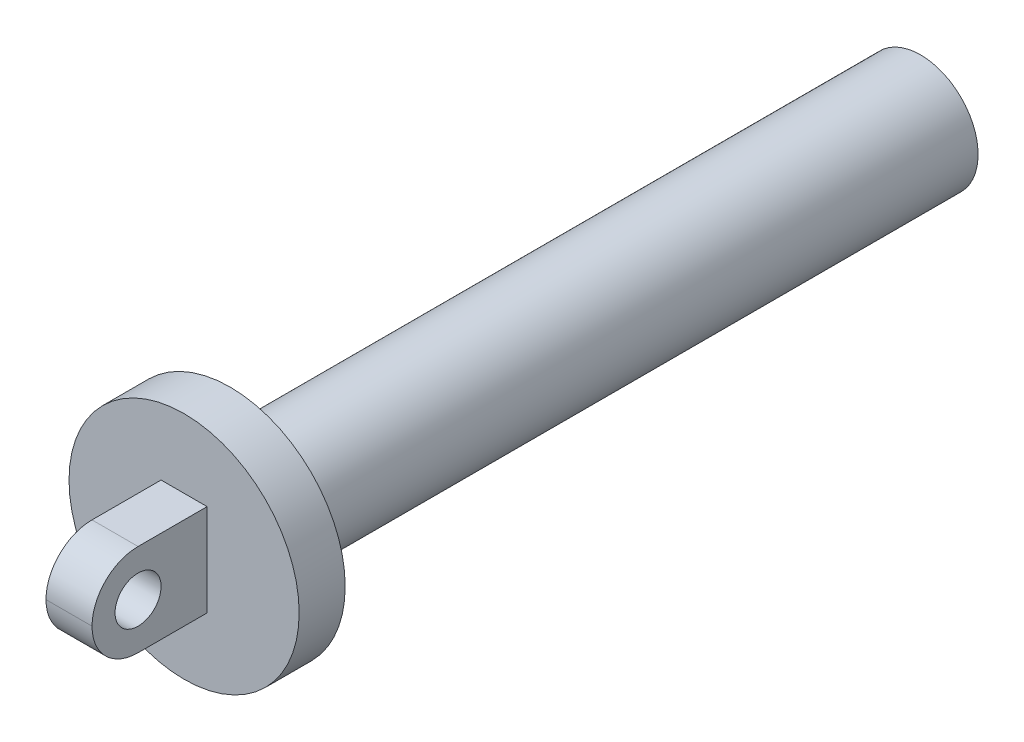
from build123d import *

# Parameters (mm, degrees)
SKETCH2_R           = 25
BOSS_EXTRUDE2_DEPTH = 10
SKETCH3_W           = 10
SKETCH3_H           = 20
BOSS_EXTRUDE3_DEPTH = 25
SKETCH4_R           = 5
CUT_EXTRUDE1_DEPTH  = 20
FILLET1_R           = 10
SKETCH5_R           = 12.5
BOSS_EXTRUDE4_DEPTH = 150


with BuildPart() as part:
    # Sketch2 → Boss-Extrude2 (new body)
    with BuildSketch(Plane.XY):
        Circle(SKETCH2_R)
    extrude(amount=BOSS_EXTRUDE2_DEPTH)

    # Sketch3 → Boss-Extrude3 (add)
    with BuildSketch(Plane.XY.offset(10)):
        Rectangle(SKETCH3_W, SKETCH3_H)
    extrude(amount=BOSS_EXTRUDE3_DEPTH)

    # Sketch4 → Cut-Extrude1 (cut)
    with BuildSketch(Plane.ZY.offset(5)):
        with Locations(Location((25, 0, 0), (0, 0, 270))):
            Circle(SKETCH4_R)
    extrude(amount=-CUT_EXTRUDE1_DEPTH, mode=Mode.SUBTRACT)

    # Fillet1
    fillet1_edges = [part.edges().sort_by_distance(p)[0] for p in [
        (0, -10, 35),
        (0, 10, 35),
    ]]
    fillet(fillet1_edges, radius=FILLET1_R - 0.0001)  # a hair under: the kernel refuses the full size

    # Sketch5 → Boss-Extrude4 (add)
    with BuildSketch(Plane(origin=(0, 0, 0), x_dir=(-1, 0, 0), z_dir=(0, 0, -1))):
        Circle(SKETCH5_R)
    extrude(amount=BOSS_EXTRUDE4_DEPTH)


solid = part.part
